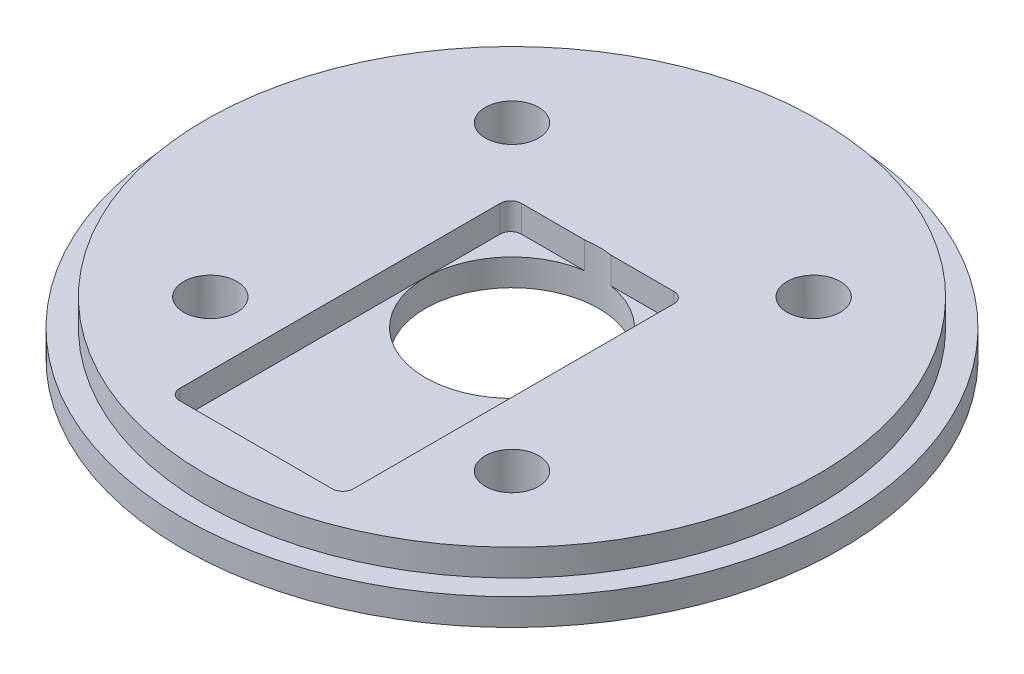
from build123d import *

# Parameters (mm, degrees)
SKETCH2_R                       = 39.243
BOSS_EXTRUDE1_DEPTH             = 6.35
CUT_EXTRUDE1_START              = -3.175
SKETCH4_R                       = 39.243
SKETCH4_R_2                     = 36.5125
CUT_EXTRUDE1_DEPTH              = 3.175
F_1_4_0_25_DIAMETER_HOLE1_D     = 6.35
F_13_16_0_8125_DIAMETER_HOLE1_D = 20.6375
SKETCH9_R                       = 6.0325
CUT_EXTRUDE2_DEPTH              = 1.5875
SKETCH11_W                      = 20.7
SKETCH11_H                      = 40.7
CUT_EXTRUDE3_DEPTH              = 3.175
FILLET1_R                       = 1.27


with BuildPart() as part:
    # Sketch2 → Boss-Extrude1 (new body)
    with BuildSketch(Plane(origin=(0, 0, 0), x_dir=(1, 0, 0), z_dir=(0, 1, 0))):
        Circle(SKETCH2_R)
    extrude(amount=BOSS_EXTRUDE1_DEPTH)

    # Sketch4 → Cut-Extrude1 (cut)
    with BuildSketch(Plane(origin=(0, 6.35, 0), x_dir=(1, 0, 0), z_dir=(0, 1, 0)).offset(CUT_EXTRUDE1_START)):
        Circle(SKETCH4_R)
        Circle(SKETCH4_R_2, mode=Mode.SUBTRACT)
    extrude(amount=CUT_EXTRUDE1_DEPTH, mode=Mode.SUBTRACT)

    # 1/4 (0.25) Diameter Hole1 (through all)
    with Locations(Plane(origin=(0, 6.35, 0), x_dir=(1, 0, 0), z_dir=(0, 1, 0))):
        with Locations((-17.960512242, 17.960512242), (-17.960512242, -17.960512242), (17.960512242, 17.960512242), (17.960512242, -17.960512242)):
            Hole(F_1_4_0_25_DIAMETER_HOLE1_D / 2)

    # 13/16 (0.8125) Diameter Hole1 (through all)
    with Locations(Plane(origin=(0, 6.35, 0), x_dir=(1, 0, 0), z_dir=(0, 1, 0))):
        with Locations((0, 0)):
            Hole(F_13_16_0_8125_DIAMETER_HOLE1_D / 2)

    # Sketch9 → Cut-Extrude2 (cut)
    with BuildSketch(Plane.XZ):
        with Locations((-17.960512242, 17.960512242)):
            Circle(SKETCH9_R)
        with Locations((17.960512242, 17.960512242)):
            Circle(SKETCH9_R)
        with Locations((17.960512242, -17.960512242)):
            Circle(SKETCH9_R)
        with Locations((-17.960512242, -17.960512242)):
            Circle(SKETCH9_R)
    extrude(amount=-CUT_EXTRUDE2_DEPTH, mode=Mode.SUBTRACT)

    # Sketch11 → Cut-Extrude3 (cut)
    with BuildSketch(Plane(origin=(0, 6.35, 0), x_dir=(1, 0, 0), z_dir=(0, 1, 0))):
        with Locations((0, -10.15)):
            Rectangle(SKETCH11_W, SKETCH11_H)
    extrude(amount=-CUT_EXTRUDE3_DEPTH, mode=Mode.SUBTRACT)

    # Fillet1
    fillet1_edges = [part.edges().sort_by_distance(p)[0] for p in [
        (-10.35, 4.7625, -10.2),
        (-10.35, 4.7625, 30.5),
        (10.35, 4.7625, 30.5),
        (10.35, 4.7625, -10.2),
    ]]
    fillet(fillet1_edges, radius=FILLET1_R)


solid = part.part
